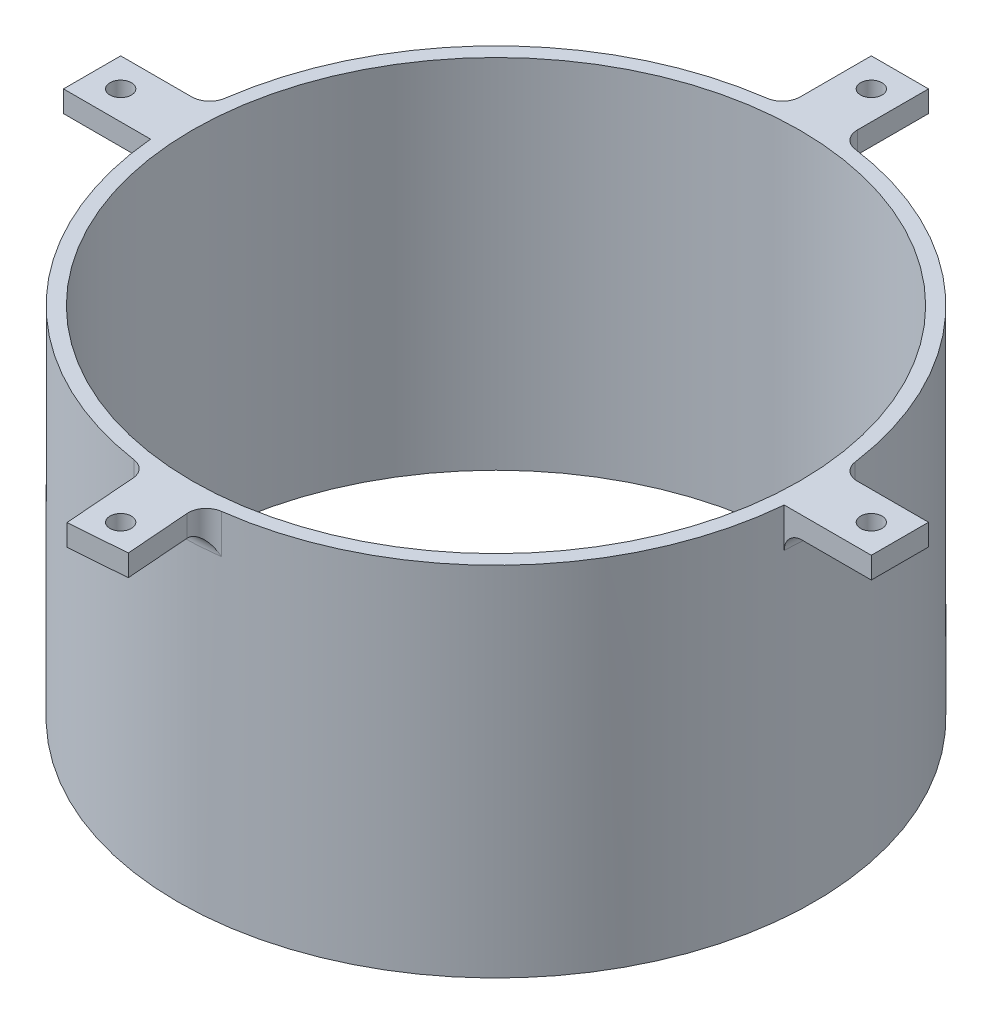
from build123d import *

# Parameters (mm, degrees)
SKETCH1_R           = 89
SKETCH1_R_2         = 85
BOSS_EXTRUDE1_DEPTH = 100
BOSS_EXTRUDE2_START = -6
SKETCH2_R           = 3
BOSS_EXTRUDE2_DEPTH = 6
FILLET1_R           = 5


with BuildPart() as part:
    # Sketch1 → Boss-Extrude1 (new body)
    with BuildSketch(Plane(origin=(0, 0, 0), x_dir=(1, 0, 0), z_dir=(0, 1, 0))):
        Circle(SKETCH1_R)
        Circle(SKETCH1_R_2, mode=Mode.SUBTRACT)
    extrude(amount=BOSS_EXTRUDE1_DEPTH)

    # Sketch2 → Boss-Extrude2 (add)
    # profile 1 of 4: a face of its own
    with BuildSketch(Plane(origin=(0, 100, 0), x_dir=(1, 0, 0), z_dir=(0, 1, 0)).offset(BOSS_EXTRUDE2_START)):
        with BuildLine():
            ThreePointArc((-8, 88.639720216), (0, 89), (8, 88.639720216))
            Line((8, 88.639720216), (8, 113))
            Line((8, 113), (-8, 113))
            Line((-8, 113), (-8, 88.639720216))
        make_face()
        with Locations((0, 105)):
            Circle(SKETCH2_R, mode=Mode.SUBTRACT)
    # profile 2 of 4: a face of its own
    with BuildSketch(Plane(origin=(0, 100, 0), x_dir=(1, 0, 0), z_dir=(0, 1, 0)).offset(BOSS_EXTRUDE2_START)):
        with BuildLine():
            Line((113, 8), (88.639720216, 8))
            ThreePointArc((88.639720216, 8), (89, 0), (88.639720216, -8))
            Line((88.639720216, -8), (113, -8))
            Line((113, -8), (113, 8))
        make_face()
        with Locations((105, 0)):
            Circle(SKETCH2_R, mode=Mode.SUBTRACT)
    # profile 3 of 4: a face of its own
    with BuildSketch(Plane(origin=(0, 100, 0), x_dir=(1, 0, 0), z_dir=(0, 1, 0)).offset(BOSS_EXTRUDE2_START)):
        with BuildLine():
            ThreePointArc((-88.639720216, -8), (-89, 0), (-88.639720216, 8))
            Line((-88.639720216, 8), (-113, 8))
            Line((-113, 8), (-113, -8))
            Line((-113, -8), (-88.639720216, -8))
        make_face()
        with Locations((-105, 0)):
            Circle(SKETCH2_R, mode=Mode.SUBTRACT)
    # profile 4 of 4: a face of its own
    with BuildSketch(Plane(origin=(0, 100, 0), x_dir=(1, 0, 0), z_dir=(0, 1, 0)).offset(BOSS_EXTRUDE2_START)):
        with BuildLine():
            Line((8.510079583, -111.370129159), (6.780952381, -88.741302023))
            ThreePointArc((6.780952381, -88.741302023), (-1.2561594, -88.991134747), (-9.283017396, -88.514550149))
            Line((-9.283017396, -88.514550149), (-7.443412916, -112.589176778))
            Line((-7.443412916, -112.589176778), (8.510079583, -111.370129159))
        make_face()
        with Locations((0, -105)):
            Circle(SKETCH2_R, mode=Mode.SUBTRACT)
    extrude(amount=BOSS_EXTRUDE2_DEPTH)

    # Fillet1
    fillet1_edges = [part.edges().sort_by_distance(p)[0] for p in [
        (-89, 94, 0),
        (-88.639720216, 97, -8),
        (88.909884431, 94, 4.004054243),
        (88.639720216, 97, -8),
        (-8, 97, -88.639720216),
        (8, 97, -88.639720216),
        (0, 94, -89),
        (6.780952381, 97, 88.741302023),
        (-1.2561594, 94, 88.991134747),
        (-9.283017396, 97, 88.514550149),
    ]]
    fillet(fillet1_edges, radius=FILLET1_R)


solid = part.part
